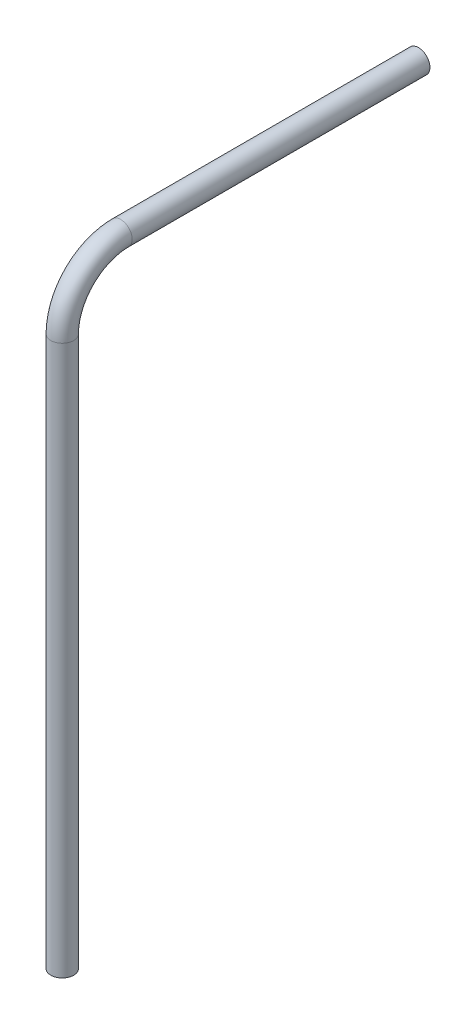
from build123d import *

# Parameters (mm, degrees)
SKETCH3_R           = 12.7
SKETCH3_R_2         = 4.7625
SKETCH4_R           = 12.7
SKETCH4_R_2         = 4.7625
BOSS_EXTRUDE3_DEPTH = 609.6
SKETCH5_R           = 12.7
SKETCH5_R_2         = 4.7625
BOSS_EXTRUDE4_DEPTH = 330.2
SKETCH6_W           = 12.7
SKETCH6_H           = 152.4
CUT_EXTRUDE1_DEPTH  = 6.35


with BuildPart() as part:
    # Sweep1: sweep along a path in Sketch2
    with BuildLine(Plane(origin=(0, 0, 0), x_dir=(0, 0, -1), z_dir=(1, 0, 0))) as sweep1_path:
        ThreePointArc((-64.833774642, 0), (-45.844401699, 45.844401699), (0, 64.833774642))
    # Sketch3 → Sweep1 (sweep)
    with BuildSketch(Plane(origin=(0, 0, 0), x_dir=(1, 0, 0), z_dir=(0, 1, 0))):
        with Locations((0, -64.833774642)):
            Circle(SKETCH3_R)
        with Locations((0, -64.833774642)):
            Circle(SKETCH3_R_2, mode=Mode.SUBTRACT)
    sweep(path=sweep1_path.line)

    # Sketch4 → Boss-Extrude3 (add)
    with BuildSketch(Plane(origin=(0, 0, 0), x_dir=(-1, 0, 0), z_dir=(0, -1, 0))):
        with Locations((0, -64.833774642)):
            Circle(SKETCH4_R)
        with Locations((0, -64.833774642)):
            Circle(SKETCH4_R_2, mode=Mode.SUBTRACT)
    extrude(amount=BOSS_EXTRUDE3_DEPTH)

    # Sketch5 → Boss-Extrude4 (add)
    with BuildSketch(Plane(origin=(0, 0, 0), x_dir=(-1, 0, 0), z_dir=(0, 0, -1))):
        with Locations((0, 64.833774642)):
            Circle(SKETCH5_R)
        with Locations((0, 64.833774642)):
            Circle(SKETCH5_R_2, mode=Mode.SUBTRACT)
    extrude(amount=BOSS_EXTRUDE4_DEPTH)

    # Sketch6 → Cut-Extrude1 (cut)
    with BuildSketch(Plane.ZY.offset(12.7)):
        with Locations((63.5, -76.2)):
            Rectangle(SKETCH6_W, SKETCH6_H)
    extrude(amount=-CUT_EXTRUDE1_DEPTH, mode=Mode.SUBTRACT)


solid = part.part
